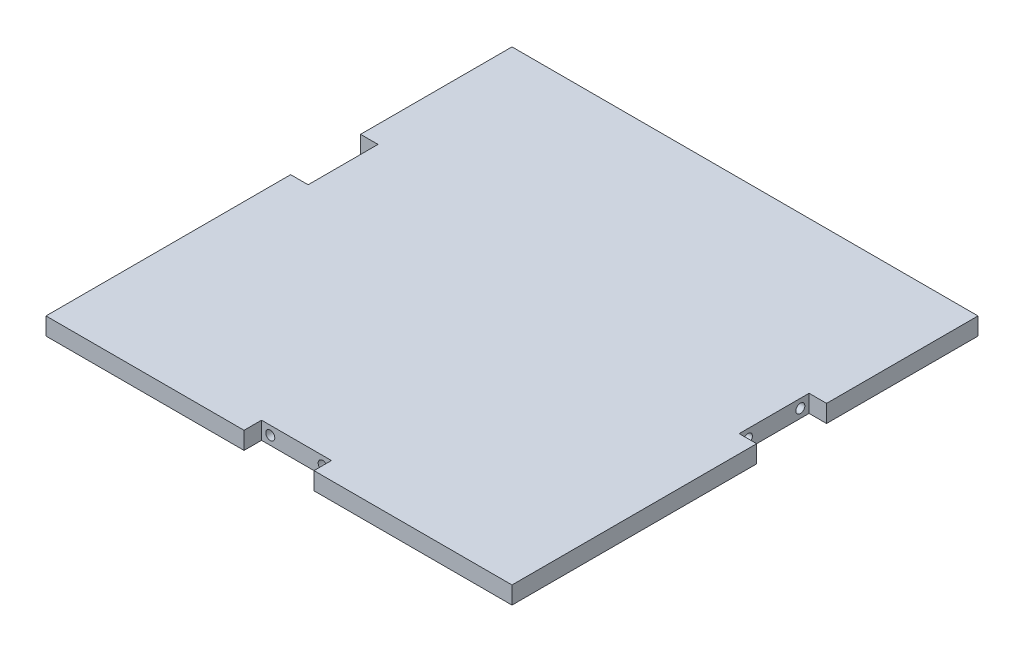
from build123d import *

# Parameters (mm, degrees)
SKETCH1_W                        = 254
SKETCH1_H                        = 254
BOSS_EXTRUDE1_DEPTH              = 9.525
SKETCH7_W                        = 9.525
SKETCH7_H                        = 38.1
SKETCH7_W_2                      = 38.1
SKETCH7_H_2                      = 9.525
CUT_EXTRUDE4_DEPTH               = 180.857514786
F_10_0_1935_DIAMETER_HOLE1_D     = 4.9149
F_10_0_1935_DIAMETER_HOLE1_DEPTH = 12.7
F_10_0_1935_DIAMETER_HOLE1_TIP   = 1.476584928
F_10_0_1935_DIAMETER_HOLE2_D     = 4.9149
F_10_0_1935_DIAMETER_HOLE2_DEPTH = 12.7
F_10_0_1935_DIAMETER_HOLE2_TIP   = 1.476584928
F_10_0_1935_DIAMETER_HOLE3_D     = 4.9149
F_10_0_1935_DIAMETER_HOLE3_DEPTH = 12.7
F_10_0_1935_DIAMETER_HOLE3_TIP   = 1.476584928


with BuildPart() as part:
    # Sketch1 → Boss-Extrude1 (new body)
    with BuildSketch(Plane(origin=(0, 0, 0), x_dir=(1, 0, 0), z_dir=(0, 1, 0))):
        Rectangle(SKETCH1_W, SKETCH1_H)
    extrude(amount=BOSS_EXTRUDE1_DEPTH)

    # Sketch7 → Cut-Extrude4 (cut, through all)
    with BuildSketch(Plane(origin=(0, 9.525, 0), x_dir=(1, 0, 0), z_dir=(0, 1, 0))):
        with Locations((-122.2375, 25.4)):
            Rectangle(SKETCH7_W, SKETCH7_H)
        with Locations((122.2375, 25.4)):
            Rectangle(SKETCH7_W, SKETCH7_H)
        with Locations((0, -122.2375)):
            Rectangle(SKETCH7_W_2, SKETCH7_H_2)
    extrude(amount=-CUT_EXTRUDE4_DEPTH, mode=Mode.SUBTRACT)

    # #10 (0.1935) Diameter Hole1
    with Locations(Plane(origin=(117.475, 0, 0), x_dir=(0, 0, -1), z_dir=(1, 0, 0))):
        with Locations((11.1125, 4.7625), (39.6875, 4.7625)):
            Hole(F_10_0_1935_DIAMETER_HOLE1_D / 2, depth=F_10_0_1935_DIAMETER_HOLE1_DEPTH)
            with Locations((0, 0, -(F_10_0_1935_DIAMETER_HOLE1_DEPTH + F_10_0_1935_DIAMETER_HOLE1_TIP / 2))):  # 118° drill point
                Cone(0, F_10_0_1935_DIAMETER_HOLE1_D / 2, F_10_0_1935_DIAMETER_HOLE1_TIP, mode=Mode.SUBTRACT)

    # #10 (0.1935) Diameter Hole2
    with Locations(Plane.XY.offset(117.475)):
        with Locations((-14.2875, 4.7625), (14.2875, 4.7625)):
            Hole(F_10_0_1935_DIAMETER_HOLE2_D / 2, depth=F_10_0_1935_DIAMETER_HOLE2_DEPTH)
            with Locations((0, 0, -(F_10_0_1935_DIAMETER_HOLE2_DEPTH + F_10_0_1935_DIAMETER_HOLE2_TIP / 2))):  # 118° drill point
                Cone(0, F_10_0_1935_DIAMETER_HOLE2_D / 2, F_10_0_1935_DIAMETER_HOLE2_TIP, mode=Mode.SUBTRACT)

    # #10 (0.1935) Diameter Hole3
    with Locations(Plane.ZY.offset(117.475)):
        with Locations((-39.6875, 4.7625), (-11.1125, 4.7625)):
            Hole(F_10_0_1935_DIAMETER_HOLE3_D / 2, depth=F_10_0_1935_DIAMETER_HOLE3_DEPTH)
            with Locations((0, 0, -(F_10_0_1935_DIAMETER_HOLE3_DEPTH + F_10_0_1935_DIAMETER_HOLE3_TIP / 2))):  # 118° drill point
                Cone(0, F_10_0_1935_DIAMETER_HOLE3_D / 2, F_10_0_1935_DIAMETER_HOLE3_TIP, mode=Mode.SUBTRACT)


solid = part.part
